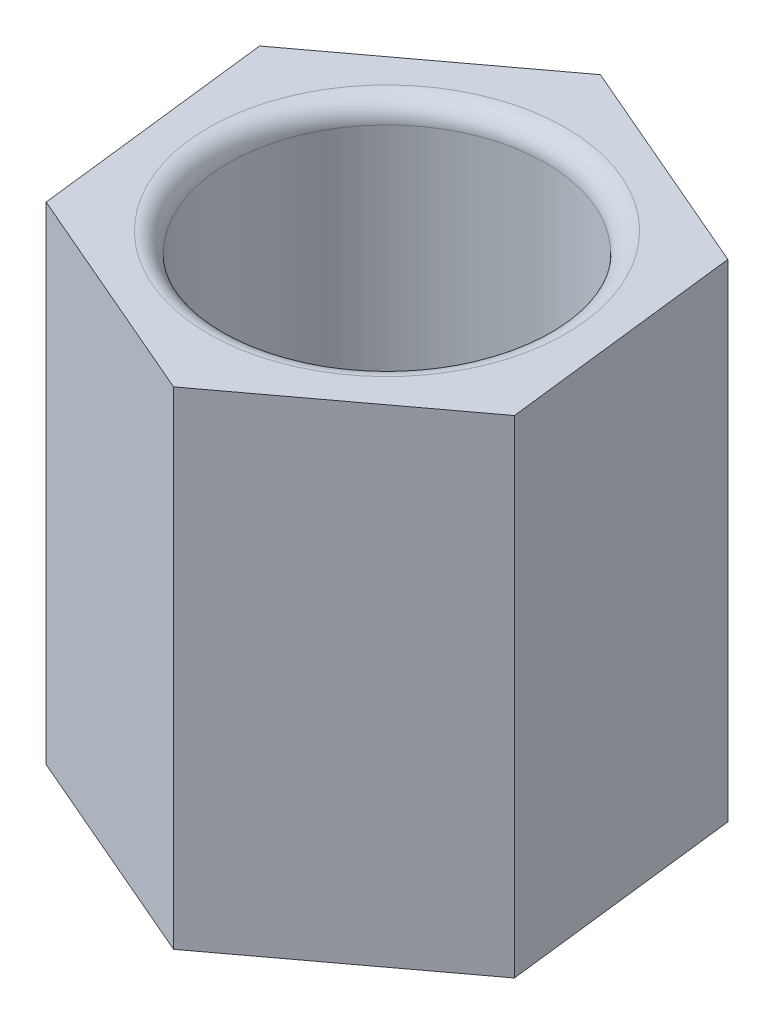
from build123d import *

# Parameters (mm, degrees)
BOSS_EXTRUDE1_DEPTH = 6
SKETCH2_R           = 1.95
CUT_EXTRUDE1_DEPTH  = 5
FILLET1_R           = 0.25


with BuildPart() as part:
    # Sketch1 → Boss-Extrude1 (new body)
    with BuildSketch(Plane(origin=(0, 0, 0), x_dir=(1, 0, 0), z_dir=(0, 1, 0))):
        Polygon((2.755572596, -1.186094291), (2.404974086, 1.793348724), (-0.35059851, 2.979443016), (-2.755572596, 1.186094291), (-2.404974086, -1.793348724), (0.35059851, -2.979443016), align=None)
    extrude(amount=BOSS_EXTRUDE1_DEPTH)

    # Sketch2 → Cut-Extrude1 (cut)
    with BuildSketch(Plane(origin=(0, 6, 0), x_dir=(1, 0, 0), z_dir=(0, 1, 0))):
        Circle(SKETCH2_R)
    extrude(amount=-CUT_EXTRUDE1_DEPTH, mode=Mode.SUBTRACT)

    # Fillet1
    fillet1_edges = [part.edges().sort_by_distance(p)[0] for p in [
        (-1.95, 6, 0),
    ]]
    fillet(fillet1_edges, radius=FILLET1_R)


solid = part.part
